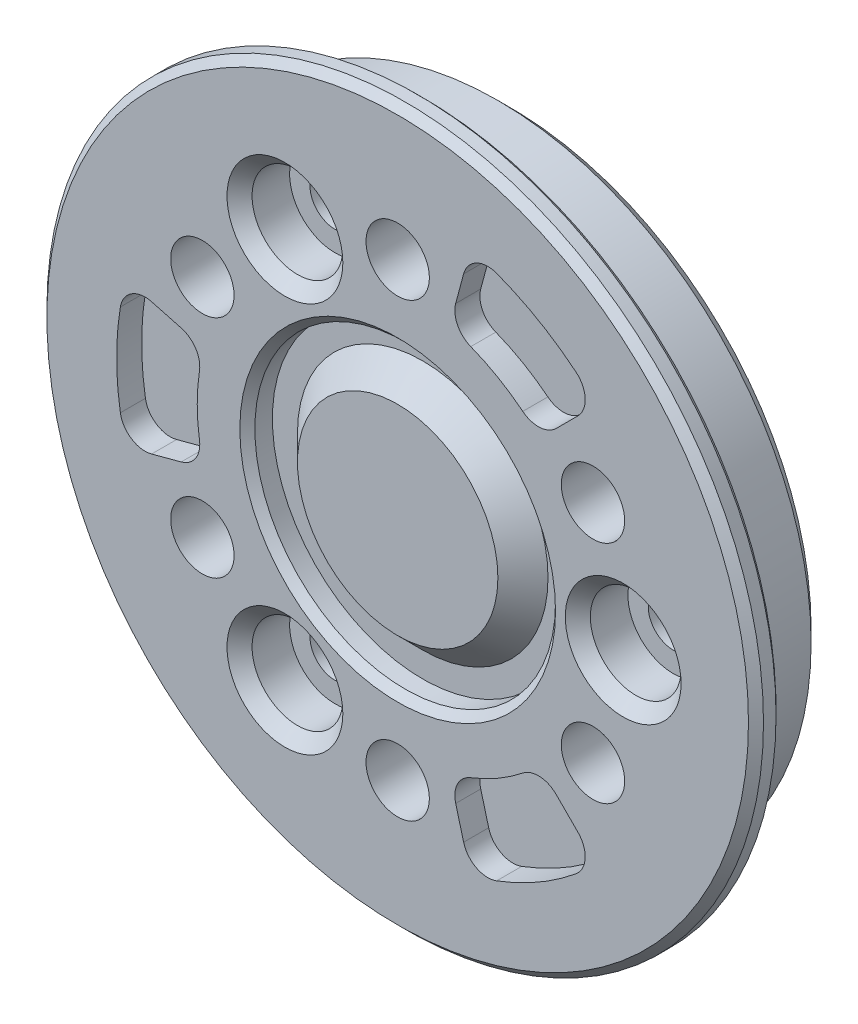
from build123d import *

# Parameters (mm, degrees)
SKETCH1_W                        = 14.3
SKETCH1_H                        = 1
SKETCH2_R                        = 12.5
BOSS_EXTRUDE1_DEPTH              = 3.5
F_7_0_7_DIAMETER_HOLE1_D         = 7
F_7_0_7_DIAMETER_HOLE1_DEPTH     = 3.3
SKETCH17_R                       = 3.5
SKETCH17_R_2                     = 3.25
BOSS_EXTRUDE3_DEPTH              = 0.5
SKETCH18_R                       = 6
CUT_EXTRUDE4_DEPTH               = 1
SKETCH19_R                       = 4
BOSS_EXTRUDE4_DEPTH              = 1
CUT_EXTRUDE1_DEPTH               = 1
CUT_EXTRUDE2_DEPTH               = 1
CUT_EXTRUDE3_DEPTH               = 1
F_2_0_2_DIAMETER_HOLE1_D         = 2
F_2_0_2_DIAMETER_HOLE1_DEPTH     = 2.3
CBORE_FOR_M1_6_SHCS1_D           = 2
CBORE_FOR_M1_6_SHCS1_CBORE_D     = 3.62300003
CBORE_FOR_M1_6_SHCS1_CBORE_DEPTH = 2
M2_CLEARANCE_HOLE1_D             = 2.529
M2_CLEARANCE_HOLE1_DEPTH         = 4
CHAMFER1_SIZE                    = 0.5
CHAMFER2_SIZE                    = 0.3
CHAMFER3_SIZE                    = 0.2
CHAMFER4_SIZE                    = 1
FILLET1_R                        = 1


with BuildPart() as part:
    # Sketch1 → Revolve1 (revolve)
    with BuildSketch(Plane(origin=(0, 0, 0), x_dir=(1, 0, 0), z_dir=(0, 1, 0))):
        with Locations((7.15, -9.7)):
            Rectangle(SKETCH1_W, SKETCH1_H)
    revolve(axis=Axis((0, 0, 9.2), (0, 0, 1)))

    # Sketch2 → Boss-Extrude1 (add)
    with BuildSketch(Plane(origin=(0, 0, 9.2), x_dir=(-1, 0, 0), z_dir=(0, 0, -1))):
        with Locations(Location((0, 0, 0), (0, 0, 180))):
            Circle(SKETCH2_R)
    extrude(amount=BOSS_EXTRUDE1_DEPTH)

    # Ø7.0 (7) Diameter Hole1
    with Locations(Plane(origin=(0, 0, 5.7), x_dir=(1, 0, 0), z_dir=(0, 0, -1))):
        with Locations((0, 0)):
            Hole(F_7_0_7_DIAMETER_HOLE1_D / 2, depth=F_7_0_7_DIAMETER_HOLE1_DEPTH)

    # Sketch17 → Boss-Extrude3 (add)
    with BuildSketch(Plane(origin=(0, 0, 9), x_dir=(-1, 0, 0), z_dir=(0, 0, -1))):
        Circle(SKETCH17_R)
        Circle(SKETCH17_R_2, mode=Mode.SUBTRACT)
    extrude(amount=BOSS_EXTRUDE3_DEPTH)

    # Sketch18 → Cut-Extrude4 (cut)
    with BuildSketch(Plane.XY.offset(10.2)):
        Circle(SKETCH18_R)
    extrude(amount=-CUT_EXTRUDE4_DEPTH, mode=Mode.SUBTRACT)

    # Sketch19 → Boss-Extrude4 (add)
    with BuildSketch(Plane.XY.offset(9.2)):
        Circle(SKETCH19_R)
    extrude(amount=BOSS_EXTRUDE4_DEPTH)

    # Sketch6 → Cut-Extrude1 (cut)
    with BuildSketch(Plane.XY.offset(10.2)):
        with BuildLine():
            Line((2.903285774, 10.835210018), (2.070552392, 7.727406725))
            ThreePointArc((2.070552392, 7.727406725), (4.00000006, 6.928203334), (5.656854334, 5.656854334))
            Line((5.656854334, 5.656854334), (7.931924244, 7.931924244))
            ThreePointArc((7.931924244, 7.931924244), (5.60871742, 9.714583538), (2.903285774, 10.835210018))
        make_face()
    extrude(amount=-CUT_EXTRUDE1_DEPTH, mode=Mode.SUBTRACT)

    # Sketch7 → Cut-Extrude2 (cut)
    with BuildSketch(Plane.XY.offset(10.2)):
        with BuildLine():
            Line((7.931924244, -7.931924244), (5.656854334, -5.656854334))
            ThreePointArc((5.656854334, -5.656854334), (4.00000006, -6.928203334), (2.070552392, -7.727406725))
            Line((2.070552392, -7.727406725), (2.903285774, -10.835210018))
            ThreePointArc((2.903285774, -10.835210018), (5.60871742, -9.714583538), (7.931924244, -7.931924244))
        make_face()
    extrude(amount=-CUT_EXTRUDE2_DEPTH, mode=Mode.SUBTRACT)

    # Sketch8 → Cut-Extrude3 (cut)
    with BuildSketch(Plane.XY.offset(10.2)):
        with BuildLine():
            Line((-10.835210018, -2.903285774), (-7.727406725, -2.070552392))
            ThreePointArc((-7.727406725, -2.070552392), (-8.000000119, 0), (-7.727406725, 2.070552392))
            Line((-7.727406725, 2.070552392), (-10.835210018, 2.903285774))
            ThreePointArc((-10.835210018, 2.903285774), (-11.217434841, 0), (-10.835210018, -2.903285774))
        make_face()
    extrude(amount=-CUT_EXTRUDE3_DEPTH, mode=Mode.SUBTRACT)

    # Ø2.0 (2) Diameter Hole1
    with Locations(Plane(origin=(0, 0, 5.7), x_dir=(-1, 0, 0), z_dir=(0, 0, -1))):
        with Locations((-4.5, 7.794228634), (9, 0), (-4.5, -7.794228634)):
            Hole(F_2_0_2_DIAMETER_HOLE1_D / 2, depth=F_2_0_2_DIAMETER_HOLE1_DEPTH)

    # CBORE for M1.6 SHCS1 (through all)
    with Locations(Plane.XY.offset(10.2)):
        with Locations((-4.5, 7.794228634), (-4.5, -7.794228634), (9, 0)):
            CounterBoreHole(CBORE_FOR_M1_6_SHCS1_D / 2, CBORE_FOR_M1_6_SHCS1_CBORE_D / 2, CBORE_FOR_M1_6_SHCS1_CBORE_DEPTH)

    # M2 Clearance Hole1
    with Locations(Plane.XY.offset(10.2)):
        with Locations((7.794228634, -4.5), (-7.794228634, -4.5), (7.794228634, 4.5), (0, -9), (-7.794228634, 4.5), (0, 9)):
            Hole(M2_CLEARANCE_HOLE1_D / 2, depth=M2_CLEARANCE_HOLE1_DEPTH)

    # Chamfer1
    chamfer1_edges = [part.edges().sort_by_distance(p)[0] for p in [
        (-6.311500015, 7.794228634, 10.2),
        (7.188499985, 0, 10.2),
        (-6.311500015, -7.794228634, 10.2),
        (-12.5, 0, 5.7),
    ]]
    chamfer(chamfer1_edges, length=CHAMFER1_SIZE)

    # Chamfer2
    chamfer2_edges = [part.edges().sort_by_distance(p)[0] for p in [
        (-6, 0, 10.2),
        (-14.3, 0, 10.2),
    ]]
    chamfer(chamfer2_edges, length=CHAMFER2_SIZE)

    # Chamfer3
    chamfer3_edges = [part.edges().sort_by_distance(p)[0] for p in [
        (-14.3, 0, 9.2),
    ]]
    chamfer(chamfer3_edges, length=CHAMFER3_SIZE)

    # Chamfer4
    chamfer4_edges = [part.edges().sort_by_distance(p)[0] for p in [
        (-4, 0, 9.2),
    ]]
    chamfer(chamfer4_edges, length=CHAMFER4_SIZE - 0.0001)  # a hair under: the kernel refuses the full size

    # Fillet1
    fillet1_edges = [part.edges().sort_by_distance(p)[0] for p in [
        (2.903285774, 10.835210018, 9.7),
        (7.931924244, 7.931924244, 9.7),
        (5.656854334, 5.656854334, 9.7),
        (2.070552392, 7.727406725, 9.7),
        (7.931924244, -7.931924244, 9.7),
        (2.903285774, -10.835210018, 9.7),
        (2.070552392, -7.727406725, 9.7),
        (5.656854334, -5.656854334, 9.7),
        (-10.835210018, -2.903285774, 9.7),
        (-10.835210018, 2.903285774, 9.7),
        (-7.727406725, 2.070552392, 9.7),
        (-7.727406725, -2.070552392, 9.7),
    ]]
    fillet(fillet1_edges, radius=FILLET1_R)


solid = part.part
